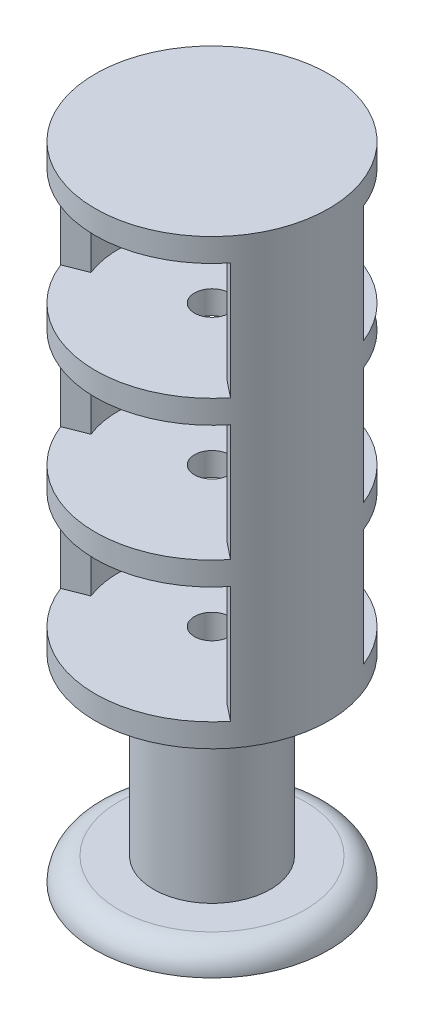
from build123d import *

# Parameters (mm, degrees)
CROQUIS1_R               = 5
SALIENTE_EXTRUIR1_DEPTH  = 15
CROQUIS1_3_R             = 10
CROQUIS1_3_R_2           = 5
SALIENTE_EXTRUIR2_DEPTH  = 2
CROQUIS2_R               = 10
SALIENTE_EXTRUIR3_DEPTH  = 2
SALIENTE_EXTRUIR4_DEPTH  = 10
CROQUIS4_R               = 10
SALIENTE_EXTRUIR5_DEPTH  = 2
SALIENTE_EXTRUIR6_START  = 12
SALIENTE_EXTRUIR6_DEPTH  = 10
CROQUIS5_R               = 10
SALIENTE_EXTRUIR7_DEPTH  = 2
SALIENTE_EXTRUIR8_START  = 24
SALIENTE_EXTRUIR8_DEPTH  = 10
CROQUIS7_R               = 10
SALIENTE_EXTRUIR9_DEPTH  = 2
CORTAR_EXTRUIR1_REACH    = 56.854
CROQUIS9_R               = 1.5
SALIENTE_EXTRUIR10_START = 2
CROQUIS10_R              = 5
CROQUIS10_R_2            = 1.5
SALIENTE_EXTRUIR10_DEPTH = 2
CROQUIS11_R              = 2.5
CORTAR_EXTRUIR2_DEPTH    = 15
REDONDEO1_R              = 2


with BuildPart() as part:
    # Croquis1 → Saliente-Extruir1 (new body)
    with BuildSketch(Plane(origin=(0, 0, 0), x_dir=(1, 0, 0), z_dir=(0, 1, 0))):
        with Locations(Location((0, 0, 0), (0, 0, 270))):
            Circle(CROQUIS1_R)
    extrude(amount=SALIENTE_EXTRUIR1_DEPTH)

    # Croquis2 → Saliente-Extruir3 (add)
    with BuildSketch(Plane(origin=(0, 15, 0), x_dir=(1, 0, 0), z_dir=(0, 1, 0))):
        with Locations(Location((0, 0, 0), (0, 0, 270))):
            Circle(CROQUIS2_R)
    extrude(amount=SALIENTE_EXTRUIR3_DEPTH)

    # Croquis3 → Saliente-Extruir4 (add)
    with BuildSketch(Plane(origin=(0, 17, 0), x_dir=(1, 0, 0), z_dir=(0, 1, 0))):
        with BuildLine():
            Line((-6.254092926, 4.988619216), (-7.817616157, 6.235774019))
            ThreePointArc((-7.817616157, 6.235774019), (-9.888141199, 1.491530635), (-9.309146792, -3.652367179))
            Line((-9.309146792, -3.652367179), (-7.447317433, -2.921893743))
            ThreePointArc((-7.447317433, -2.921893743), (-7.910512959, 1.193224508), (-6.254092926, 4.988619216))
        make_face()
        with BuildLine():
            ThreePointArc((7.817616157, -6.235774019), (9.888141199, -1.491530635), (9.309146792, 3.652367179))
            Line((9.309146792, 3.652367179), (7.447317433, 2.921893743))
            ThreePointArc((7.447317433, 2.921893743), (7.910512959, -1.193224508), (6.254092926, -4.988619216))
            Line((6.254092926, -4.988619216), (7.817616157, -6.235774019))
        make_face()
    extrude(amount=SALIENTE_EXTRUIR4_DEPTH)

    # Croquis4 → Saliente-Extruir5 (add)
    with BuildSketch(Plane(origin=(0, 27, 0), x_dir=(1, 0, 0), z_dir=(0, 1, 0))):
        with Locations(Location((0, 0, 0), (0, 0, 270))):
            Circle(CROQUIS4_R)
    extrude(amount=SALIENTE_EXTRUIR5_DEPTH)

    # Croquis3<3> → Saliente-Extruir6 (add)
    with BuildSketch(Plane(origin=(0, 17, 0), x_dir=(1, 0, 0), z_dir=(0, 1, 0)).offset(SALIENTE_EXTRUIR6_START)):
        with BuildLine():
            Line((-6.254092926, 4.988619216), (-7.817616157, 6.235774019))
            ThreePointArc((-7.817616157, 6.235774019), (-9.888141199, 1.491530635), (-9.309146792, -3.652367179))
            Line((-9.309146792, -3.652367179), (-7.447317433, -2.921893743))
            ThreePointArc((-7.447317433, -2.921893743), (-7.910512959, 1.193224508), (-6.254092926, 4.988619216))
        make_face()
        with BuildLine():
            ThreePointArc((7.817616157, -6.235774019), (9.888141199, -1.491530635), (9.309146792, 3.652367179))
            Line((9.309146792, 3.652367179), (7.447317433, 2.921893743))
            ThreePointArc((7.447317433, 2.921893743), (7.910512959, -1.193224508), (6.254092926, -4.988619216))
            Line((6.254092926, -4.988619216), (7.817616157, -6.235774019))
        make_face()
    extrude(amount=SALIENTE_EXTRUIR6_DEPTH)

    # Croquis5 → Saliente-Extruir7 (add)
    with BuildSketch(Plane(origin=(0, 39, 0), x_dir=(1, 0, 0), z_dir=(0, 1, 0))):
        with Locations(Location((0, 0, 0), (0, 0, 270))):
            Circle(CROQUIS5_R)
    extrude(amount=SALIENTE_EXTRUIR7_DEPTH)

    # Croquis3<4> → Saliente-Extruir8 (add)
    with BuildSketch(Plane(origin=(0, 17, 0), x_dir=(1, 0, 0), z_dir=(0, 1, 0)).offset(SALIENTE_EXTRUIR8_START)):
        with BuildLine():
            Line((-6.254092926, 4.988619216), (-7.817616157, 6.235774019))
            ThreePointArc((-7.817616157, 6.235774019), (-9.888141199, 1.491530635), (-9.309146792, -3.652367179))
            Line((-9.309146792, -3.652367179), (-7.447317433, -2.921893743))
            ThreePointArc((-7.447317433, -2.921893743), (-7.910512959, 1.193224508), (-6.254092926, 4.988619216))
        make_face()
        with BuildLine():
            ThreePointArc((7.817616157, -6.235774019), (9.888141199, -1.491530635), (9.309146792, 3.652367179))
            Line((9.309146792, 3.652367179), (7.447317433, 2.921893743))
            ThreePointArc((7.447317433, 2.921893743), (7.910512959, -1.193224508), (6.254092926, -4.988619216))
            Line((6.254092926, -4.988619216), (7.817616157, -6.235774019))
        make_face()
    extrude(amount=SALIENTE_EXTRUIR8_DEPTH)

    # Croquis7 → Saliente-Extruir9 (add)
    with BuildSketch(Plane(origin=(0, 51, 0), x_dir=(1, 0, 0), z_dir=(0, 1, 0))):
        with Locations(Location((0, 0, 0), (0, 0, 270))):
            Circle(CROQUIS7_R)
    extrude(amount=SALIENTE_EXTRUIR9_DEPTH)

    # Cortar-Extruir1: up to this face of the body (flat: up to its plane)
    cortar_extruir1_end = Plane(part.part.faces().sort_by_distance((0, 51, 0))[0])
    # Croquis9 → Cortar-Extruir1 (cut, up to the picked face)
    with BuildSketch(Plane.XZ, mode=Mode.PRIVATE) as cortar_extruir1_sk1:
        with Locations(Location((0, 0, 0), (0, 0, 90))):
            Circle(CROQUIS9_R)
    cortar_extruir1_tool1 = split(extrude(cortar_extruir1_sk1.sketch, amount=-CORTAR_EXTRUIR1_REACH, mode=Mode.PRIVATE), bisect_by=cortar_extruir1_end, keep=Keep.BOTH, mode=Mode.PRIVATE)
    add(cortar_extruir1_tool1.solids().sort_by(Axis((0, 0, 0), (0, 1, 0)))[0], mode=Mode.SUBTRACT)



with BuildPart() as body_2:
    # Croquis1<3> → Saliente-Extruir2 (new body)
    with BuildSketch(Plane(origin=(0, 0, 0), x_dir=(1, 0, 0), z_dir=(0, 1, 0))):
        with Locations(Location((0, 0, 0), (0, 0, 270))):
            Circle(CROQUIS1_3_R)
        with Locations(Location((0, 0, 0), (0, 0, 270))):
            Circle(CROQUIS1_3_R_2, mode=Mode.SUBTRACT)
    extrude(amount=-SALIENTE_EXTRUIR2_DEPTH)


with BuildPart() as part_1:
    add(part.part)

    add(body_2.part)  # Saliente-Extruir10 merges body 2
    # Croquis10 → Saliente-Extruir10 (add)
    with BuildSketch(Plane.XZ.offset(SALIENTE_EXTRUIR10_START)):
        with Locations(Location((0, 0, 0), (0, 0, 90))):
            Circle(CROQUIS10_R)
        with Locations(Location((0, 0, 0), (0, 0, 90))):
            Circle(CROQUIS10_R_2, mode=Mode.SUBTRACT)
    extrude(amount=-SALIENTE_EXTRUIR10_DEPTH)

    # Croquis11 → Cortar-Extruir2 (cut)
    with BuildSketch(Plane.XZ.offset(2)):
        with Locations(Location((0, 0, 0), (0, 0, 270))):
            Circle(CROQUIS11_R)
    extrude(amount=-CORTAR_EXTRUIR2_DEPTH, mode=Mode.SUBTRACT)

    # Redondeo1
    redondeo1_edges = [part_1.edges().sort_by_distance(p)[0] for p in [
        (0, 0, -10),
    ]]
    fillet(redondeo1_edges, radius=REDONDEO1_R - 0.0001)  # a hair under: the kernel refuses the full size


solid = part_1.part
